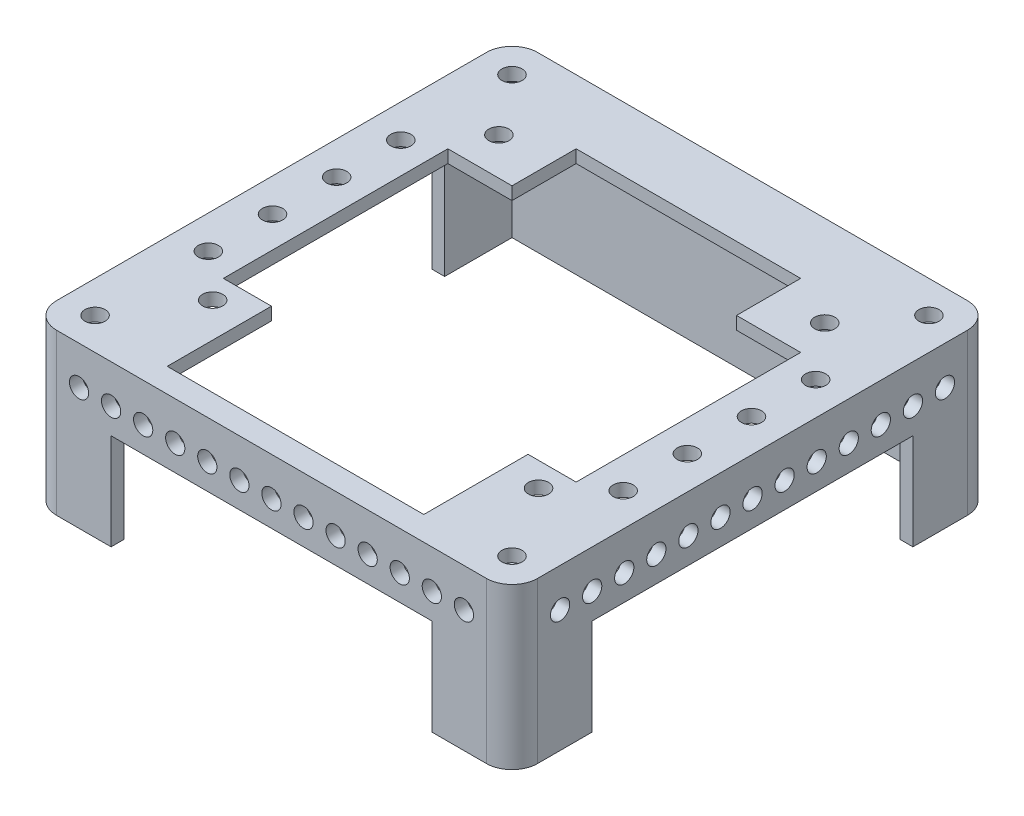
from build123d import *

# Parameters (mm, degrees)
SKETCH9_R                 = 3.15
BOSS_EXTRUDE10_DEPTH      = 10
BOSS_EXTRUDE10_2_DEPTH    = 10
BOSS_EXTRUDE10_3_DEPTH    = 10
BOSS_EXTRUDE10_4_DEPTH    = 10
BOSS_EXTRUDE10_5_DEPTH    = 10
BOSS_EXTRUDE10_6_DEPTH    = 10
BOSS_EXTRUDE10_7_DEPTH    = 10
BOSS_EXTRUDE10_8_DEPTH    = 10
BOSS_EXTRUDE12_DEPTH      = 10
SKETCH15_R                = 3.15
BOSS_EXTRUDE17_DEPTH      = 10
BOSS_EXTRUDE17_2_DEPTH    = 10
BOSS_EXTRUDE17_3_DEPTH    = 10
BOSS_EXTRUDE17_4_DEPTH    = 10
SKETCH22_W                = 150
SKETCH22_H                = 150
BOSS_EXTRUDE19_DEPTH      = 4
SKETCH29_W                = 150
SKETCH29_H                = 150
SKETCH29_W_2              = 142
SKETCH29_H_2              = 142
BOSS_EXTRUDE20_DEPTH      = 50
FILLET12_R                = 8
BOSS_EXTRUDE21_START      = -20
SKETCH31_W                = 8
SKETCH31_H                = 100
BOSS_EXTRUDE21_DEPTH      = 100
BOSS_EXTRUDE21_2_DEPTH    = 100
SKETCH31_W_2              = 100
SKETCH31_H_2              = 8
BOSS_EXTRUDE21_3_DEPTH    = 100
SKETCH35_R                = 3.15
BOSS_EXTRUDE25_DEPTH      = 10
BOSS_EXTRUDE25_2_DEPTH    = 10
BOSS_EXTRUDE25_3_DEPTH    = 10
BOSS_EXTRUDE25_4_DEPTH    = 10
BOSS_EXTRUDE27_DEPTH      = 11
BOSS_EXTRUDE27_DEPTH_BACK = 46
SKETCH38_W                = 80
SKETCH38_H                = 35.561756734
BOSS_EXTRUDE28_DEPTH      = 3
BOSS_EXTRUDE28_2_DEPTH    = 3
BOSS_EXTRUDE28_3_DEPTH    = 3
BOSS_EXTRUDE28_4_DEPTH    = 3
SKETCH40_W                = 20
SKETCH40_H                = 20
BOSS_EXTRUDE31_DEPTH      = 4.5
BOSS_EXTRUDE31_2_DEPTH    = 4.5
BOSS_EXTRUDE31_3_DEPTH    = 4.5
BOSS_EXTRUDE31_4_DEPTH    = 4.5
FILLET14_R                = 15
SKETCH42_R                = 3
CUT_EXTRUDE1_DEPTH        = 10
SKETCH45_R                = 3
CUT_EXTRUDE2_DEPTH        = 174.899396204


with BuildPart() as part:
    # Sketch9 → Boss-Extrude10 (new, symmetric)
    with BuildSketch(Plane(origin=(0, 0, 0), x_dir=(1, 0, 0), z_dir=(0, 1, 0))):
        with Locations(Location((64.67, -30, 0), (0, 0, 270))):
            Circle(SKETCH9_R)
    extrude(amount=BOSS_EXTRUDE10_DEPTH, both=True)


with BuildPart() as body_2:
    # Sketch9 → Boss-Extrude10 2 (new, symmetric)
    with BuildSketch(Plane(origin=(0, 0, 0), x_dir=(1, 0, 0), z_dir=(0, 1, 0))):
        with Locations(Location((-64.67, -30, 0), (0, 0, 270))):
            Circle(SKETCH9_R)
    extrude(amount=BOSS_EXTRUDE10_2_DEPTH, both=True)


with BuildPart() as body_3:
    # Sketch9 → Boss-Extrude10 3 (new, symmetric)
    with BuildSketch(Plane(origin=(0, 0, 0), x_dir=(1, 0, 0), z_dir=(0, 1, 0))):
        with Locations(Location((64.67, -10, 0), (0, 0, 270))):
            Circle(SKETCH9_R)
    extrude(amount=BOSS_EXTRUDE10_3_DEPTH, both=True)


with BuildPart() as body_4:
    # Sketch9 → Boss-Extrude10 4 (new, symmetric)
    with BuildSketch(Plane(origin=(0, 0, 0), x_dir=(1, 0, 0), z_dir=(0, 1, 0))):
        with Locations(Location((-64.67, -10, 0), (0, 0, 270))):
            Circle(SKETCH9_R)
    extrude(amount=BOSS_EXTRUDE10_4_DEPTH, both=True)


with BuildPart() as body_5:
    # Sketch9 → Boss-Extrude10 5 (new, symmetric)
    with BuildSketch(Plane(origin=(0, 0, 0), x_dir=(1, 0, 0), z_dir=(0, 1, 0))):
        with Locations(Location((64.67, 10, 0), (0, 0, 270))):
            Circle(SKETCH9_R)
    extrude(amount=BOSS_EXTRUDE10_5_DEPTH, both=True)


with BuildPart() as body_6:
    # Sketch9 → Boss-Extrude10 6 (new, symmetric)
    with BuildSketch(Plane(origin=(0, 0, 0), x_dir=(1, 0, 0), z_dir=(0, 1, 0))):
        with Locations(Location((-64.67, 10, 0), (0, 0, 270))):
            Circle(SKETCH9_R)
    extrude(amount=BOSS_EXTRUDE10_6_DEPTH, both=True)


with BuildPart() as body_7:
    # Sketch9 → Boss-Extrude10 7 (new, symmetric)
    with BuildSketch(Plane(origin=(0, 0, 0), x_dir=(1, 0, 0), z_dir=(0, 1, 0))):
        with Locations(Location((64.67, 30, 0), (0, 0, 270))):
            Circle(SKETCH9_R)
    extrude(amount=BOSS_EXTRUDE10_7_DEPTH, both=True)


with BuildPart() as body_8:
    # Sketch9 → Boss-Extrude10 8 (new, symmetric)
    with BuildSketch(Plane(origin=(0, 0, 0), x_dir=(1, 0, 0), z_dir=(0, 1, 0))):
        with Locations(Location((-64.67, 30, 0), (0, 0, 270))):
            Circle(SKETCH9_R)
    extrude(amount=BOSS_EXTRUDE10_8_DEPTH, both=True)


with BuildPart() as body_9:
    # Sketch10 → Boss-Extrude12 (new, symmetric)
    with BuildSketch(Plane(origin=(0, 0, 0), x_dir=(1, 0, 0), z_dir=(0, 1, 0))):
        Polygon((35, -55), (35, -35), (55, -35), (55, 35), (35, 35), (35, 55), (-35, 55), (-35, 35), (-55, 35), (-55, -35), (-35, -35), (-35, -55), align=None)
    extrude(amount=BOSS_EXTRUDE12_DEPTH, both=True)


with BuildPart() as body_10:
    # Sketch15 → Boss-Extrude17 (new, symmetric)
    with BuildSketch(Plane(origin=(0, 0, 0), x_dir=(1, 0, 0), z_dir=(0, 1, 0))):
        with Locations(Location((-50.8, 46.711, 0), (0, 0, 270))):
            Circle(SKETCH15_R)
    extrude(amount=BOSS_EXTRUDE17_DEPTH, both=True)


with BuildPart() as body_11:
    # Sketch15 → Boss-Extrude17 2 (new, symmetric)
    with BuildSketch(Plane(origin=(0, 0, 0), x_dir=(1, 0, 0), z_dir=(0, 1, 0))):
        with Locations(Location((50.8, -42.532, 0), (0, 0, 270))):
            Circle(SKETCH15_R)
    extrude(amount=BOSS_EXTRUDE17_2_DEPTH, both=True)


with BuildPart() as body_12:
    # Sketch15 → Boss-Extrude17 3 (new, symmetric)
    with BuildSketch(Plane(origin=(0, 0, 0), x_dir=(1, 0, 0), z_dir=(0, 1, 0))):
        with Locations(Location((-50.8, -42.532, 0), (0, 0, 270))):
            Circle(SKETCH15_R)
    extrude(amount=BOSS_EXTRUDE17_3_DEPTH, both=True)


with BuildPart() as body_13:
    # Sketch15 → Boss-Extrude17 4 (new, symmetric)
    with BuildSketch(Plane(origin=(0, 0, 0), x_dir=(1, 0, 0), z_dir=(0, 1, 0))):
        with Locations(Location((50.8, 46.711, 0), (0, 0, 270))):
            Circle(SKETCH15_R)
    extrude(amount=BOSS_EXTRUDE17_4_DEPTH, both=True)


with BuildPart() as body_10_1:
    # Body-Move/Copy4: moved
    add(body_10.part.moved(Location((0, 1, 0))))


with BuildPart() as body_13_1:
    # Body-Move/Copy4: moved
    add(body_13.part.moved(Location((0, 1, 0))))


with BuildPart() as body_12_1:
    # Body-Move/Copy4: moved
    add(body_12.part.moved(Location((0, 1, 0))))


with BuildPart() as body_11_1:
    # Body-Move/Copy4: moved
    add(body_11.part.moved(Location((0, 1, 0))))


with BuildPart() as body_14:
    # Sketch22 → Boss-Extrude19 (new body)
    with BuildSketch(Plane(origin=(0, 0, 0), x_dir=(1, 0, 0), z_dir=(0, 1, 0))):
        Rectangle(SKETCH22_W, SKETCH22_H)
    extrude(amount=BOSS_EXTRUDE19_DEPTH)

    # Sketch29 → Boss-Extrude20 (add)
    with BuildSketch(Plane(origin=(0, 4, 0), x_dir=(1, 0, 0), z_dir=(0, 1, 0))):
        Rectangle(SKETCH29_W, SKETCH29_H)
        Rectangle(SKETCH29_W_2, SKETCH29_H_2, mode=Mode.SUBTRACT)
    extrude(amount=-BOSS_EXTRUDE20_DEPTH)

    # Fillet12
    fillet12_edges = [body_14.edges().sort_by_distance(p)[0] for p in [
        (75, -21, 75),
        (-75, -21, 75),
        (-75, -21, -75),
        (75, -21, -75),
    ]]
    fillet(fillet12_edges, radius=FILLET12_R)


with BuildPart() as body_15:
    # Sketch31 → Boss-Extrude21 (new body)
    with BuildSketch(Plane(origin=(0, 4, 0), x_dir=(1, 0, 0), z_dir=(0, 1, 0)).offset(BOSS_EXTRUDE21_START)):
        with Locations((-75, 0)):
            Rectangle(SKETCH31_W, SKETCH31_H)
    extrude(amount=-BOSS_EXTRUDE21_DEPTH)


with BuildPart() as body_16:
    # Sketch31 → Boss-Extrude21 2 (new body)
    with BuildSketch(Plane(origin=(0, 4, 0), x_dir=(1, 0, 0), z_dir=(0, 1, 0)).offset(BOSS_EXTRUDE21_START)):
        with Locations((75, 0)):
            Rectangle(SKETCH31_W, SKETCH31_H)
    extrude(amount=-BOSS_EXTRUDE21_2_DEPTH)


with BuildPart() as body_17:
    # Sketch31 → Boss-Extrude21 3 (new body)
    with BuildSketch(Plane(origin=(0, 4, 0), x_dir=(1, 0, 0), z_dir=(0, 1, 0)).offset(BOSS_EXTRUDE21_START)):
        with Locations((0, -75)):
            Rectangle(SKETCH31_W_2, SKETCH31_H_2)
    extrude(amount=-BOSS_EXTRUDE21_3_DEPTH)


with BuildPart() as body_14_1:
    add(body_14.part)

    # Combine4: cut body 15, body 16, body 17
    add(body_15.part, mode=Mode.SUBTRACT)
    add(body_16.part, mode=Mode.SUBTRACT)
    add(body_17.part, mode=Mode.SUBTRACT)


with BuildPart() as body_15_2:
    # Sketch35 → Boss-Extrude25 (new, symmetric)
    with BuildSketch(Plane(origin=(0, 0, 0), x_dir=(1, 0, 0), z_dir=(0, 1, 0))):
        with Locations(Location((65, -65, 0), (0, 0, 270))):
            Circle(SKETCH35_R)
    extrude(amount=BOSS_EXTRUDE25_DEPTH, both=True)


with BuildPart() as body_16_2:
    # Sketch35 → Boss-Extrude25 2 (new, symmetric)
    with BuildSketch(Plane(origin=(0, 0, 0), x_dir=(1, 0, 0), z_dir=(0, 1, 0))):
        with Locations(Location((-65, 65, 0), (0, 0, 270))):
            Circle(SKETCH35_R)
    extrude(amount=BOSS_EXTRUDE25_2_DEPTH, both=True)


with BuildPart() as body_17_2:
    # Sketch35 → Boss-Extrude25 3 (new, symmetric)
    with BuildSketch(Plane(origin=(0, 0, 0), x_dir=(1, 0, 0), z_dir=(0, 1, 0))):
        with Locations(Location((-65, -65, 0), (0, 0, 270))):
            Circle(SKETCH35_R)
    extrude(amount=BOSS_EXTRUDE25_3_DEPTH, both=True)


with BuildPart() as body_18:
    # Sketch35 → Boss-Extrude25 4 (new, symmetric)
    with BuildSketch(Plane(origin=(0, 0, 0), x_dir=(1, 0, 0), z_dir=(0, 1, 0))):
        with Locations(Location((65, 65, 0), (0, 0, 270))):
            Circle(SKETCH35_R)
    extrude(amount=BOSS_EXTRUDE25_4_DEPTH, both=True)


with BuildPart() as body_19:
    # Sketch38 → Boss-Extrude27 (new, two sides: drawn at the far end of the back side and taken through both)
    with BuildSketch(Plane(origin=(0, 0, 0), x_dir=(1, 0, 0), z_dir=(0, 1, 0)).offset(-BOSS_EXTRUDE27_DEPTH_BACK)):
        with Locations((0, -49.719121633)):
            Rectangle(SKETCH38_W, SKETCH38_H)
    extrude(amount=BOSS_EXTRUDE27_DEPTH + BOSS_EXTRUDE27_DEPTH_BACK)


with BuildPart() as body_14_2:
    add(body_14_1.part)

    # Combine12: cut body 19, body 17 2, body 16 2, body 15 2, body 18
    add(body_19.part, mode=Mode.SUBTRACT)
    add(body_17_2.part, mode=Mode.SUBTRACT)
    add(body_16_2.part, mode=Mode.SUBTRACT)
    add(body_15_2.part, mode=Mode.SUBTRACT)
    add(body_18.part, mode=Mode.SUBTRACT)

    # Combine13: cut body 11, body 12, body 13, body 10, body 9, body 2, part
    add(body_11_1.part, mode=Mode.SUBTRACT)
    add(body_12_1.part, mode=Mode.SUBTRACT)
    add(body_13_1.part, mode=Mode.SUBTRACT)
    add(body_10_1.part, mode=Mode.SUBTRACT)
    add(body_9.part, mode=Mode.SUBTRACT)
    add(body_2.part, mode=Mode.SUBTRACT)
    add(part.part, mode=Mode.SUBTRACT)


with BuildPart() as body_8_2:
    # Sketch36 → Boss-Extrude28 (new body)
    with BuildSketch(Plane(origin=(0, 0, 0), x_dir=(1, 0, 0), z_dir=(0, 1, 0))):
        with BuildLine():
            Line((-40.150757595, -52.878679656), (-57.121320344, -69.849242405))
            ThreePointArc((-57.121320344, -69.849242405), (-69.849242405, -69.849242405), (-69.849242405, -57.121320344))
            Line((-69.849242405, -57.121320344), (-52.878679656, -40.150757595))
            ThreePointArc((-52.878679656, -40.150757595), (-40.150757595, -40.150757595), (-40.150757595, -52.878679656))
        make_face()
    extrude(amount=-BOSS_EXTRUDE28_DEPTH)


with BuildPart() as body_9_2:
    # Sketch36 → Boss-Extrude28 2 (new body)
    with BuildSketch(Plane(origin=(0, 0, 0), x_dir=(1, 0, 0), z_dir=(0, 1, 0))):
        with BuildLine():
            Line((-52.878679656, 40.150757595), (-69.849242405, 57.121320344))
            ThreePointArc((-69.849242405, 57.121320344), (-69.849242405, 69.849242405), (-57.121320344, 69.849242405))
            Line((-57.121320344, 69.849242405), (-40.150757595, 52.878679656))
            ThreePointArc((-40.150757595, 52.878679656), (-40.150757595, 40.150757595), (-52.878679656, 40.150757595))
        make_face()
    extrude(amount=-BOSS_EXTRUDE28_2_DEPTH)


with BuildPart() as body_10_2:
    # Sketch36 → Boss-Extrude28 3 (new body)
    with BuildSketch(Plane(origin=(0, 0, 0), x_dir=(1, 0, 0), z_dir=(0, 1, 0))):
        with BuildLine():
            Line((52.878679656, -40.150757595), (69.849242405, -57.121320344))
            ThreePointArc((69.849242405, -57.121320344), (69.849242405, -69.849242405), (57.121320344, -69.849242405))
            Line((57.121320344, -69.849242405), (40.150757595, -52.878679656))
            ThreePointArc((40.150757595, -52.878679656), (40.150757595, -40.150757595), (52.878679656, -40.150757595))
        make_face()
    extrude(amount=-BOSS_EXTRUDE28_3_DEPTH)


with BuildPart() as body_11_2:
    # Sketch36 → Boss-Extrude28 4 (new body)
    with BuildSketch(Plane(origin=(0, 0, 0), x_dir=(1, 0, 0), z_dir=(0, 1, 0))):
        with BuildLine():
            Line((40.150757595, 52.878679656), (57.121320344, 69.849242405))
            ThreePointArc((57.121320344, 69.849242405), (69.849242405, 69.849242405), (69.849242405, 57.121320344))
            Line((69.849242405, 57.121320344), (52.878679656, 40.150757595))
            ThreePointArc((52.878679656, 40.150757595), (40.150757595, 40.150757595), (40.150757595, 52.878679656))
        make_face()
    extrude(amount=-BOSS_EXTRUDE28_4_DEPTH)


with BuildPart() as body_12_2:
    # Sketch40 → Boss-Extrude31 (new body)
    with BuildSketch(Plane(origin=(0, 0, 0), x_dir=(1, 0, 0), z_dir=(0, 1, 0))):
        with Locations((61, -61)):
            Rectangle(SKETCH40_W, SKETCH40_H)
    extrude(amount=-BOSS_EXTRUDE31_DEPTH)


with BuildPart() as body_13_2:
    # Sketch40 → Boss-Extrude31 2 (new body)
    with BuildSketch(Plane(origin=(0, 0, 0), x_dir=(1, 0, 0), z_dir=(0, 1, 0))):
        with Locations((61, 61)):
            Rectangle(SKETCH40_W, SKETCH40_H)
    extrude(amount=-BOSS_EXTRUDE31_2_DEPTH)


with BuildPart() as body_14_2_1:
    # Sketch40 → Boss-Extrude31 3 (new body)
    with BuildSketch(Plane(origin=(0, 0, 0), x_dir=(1, 0, 0), z_dir=(0, 1, 0))):
        with Locations((-61, 61)):
            Rectangle(SKETCH40_W, SKETCH40_H)
    extrude(amount=-BOSS_EXTRUDE31_3_DEPTH)


with BuildPart() as body_15_3:
    # Sketch40 → Boss-Extrude31 4 (new body)
    with BuildSketch(Plane(origin=(0, 0, 0), x_dir=(1, 0, 0), z_dir=(0, 1, 0))):
        with Locations((-61, -61)):
            Rectangle(SKETCH40_W, SKETCH40_H)
    extrude(amount=-BOSS_EXTRUDE31_4_DEPTH)


with BuildPart() as body_12_2_1:
    add(body_12_2.part)

    # Combine15: union body 13 2, body 14 2, body 15 3, body 14
    add(body_13_2.part)
    add(body_14_2_1.part)
    add(body_15_3.part)
    add(body_14_2.part)

    # Combine16: cut body 11 2, body 10 2, body 9 2, body 8 2
    add(body_11_2.part, mode=Mode.SUBTRACT)
    add(body_10_2.part, mode=Mode.SUBTRACT)
    add(body_9_2.part, mode=Mode.SUBTRACT)
    add(body_8_2.part, mode=Mode.SUBTRACT)

    # Combine17: cut body 8, body 7, body 6, body 5, body 4, body 3
    add(body_8.part, mode=Mode.SUBTRACT)
    add(body_7.part, mode=Mode.SUBTRACT)
    add(body_6.part, mode=Mode.SUBTRACT)
    add(body_5.part, mode=Mode.SUBTRACT)
    add(body_4.part, mode=Mode.SUBTRACT)
    add(body_3.part, mode=Mode.SUBTRACT)

    # Fillet14
    # the kernel refuses this fillet: 15 mm, written as the material it takes off along each edge
    with BuildSketch(Plane(origin=(-51, 34.5, 51), x_dir=(-1, 0, 0), z_dir=(0, -1, 0))) as fillet14_piece_1_section:
        with BuildLine():
            CenterArc((FILLET14_R, -FILLET14_R), FILLET14_R, 90, 90)
            Line((0, -FILLET14_R), (0, 0))
            Line((0, 0), (FILLET14_R, 0))
        make_face()
    fillet14_piece_1 = extrude(amount=76.5, mode=Mode.PRIVATE)
    fillet14_piece_1 = split(fillet14_piece_1, bisect_by=Plane(origin=(-64.35249566, 0, 51.045676814), z_dir=(0, -1, 0)), keep=Keep.TOP, mode=Mode.PRIVATE)
    add(fillet14_piece_1, mode=Mode.SUBTRACT)
    with BuildSketch(Plane(origin=(-51, 34.5, -51), x_dir=(-1, 0, 0), z_dir=(0, -1, 0))) as fillet14_piece_2_section:
        with BuildLine():
            CenterArc((FILLET14_R, FILLET14_R), FILLET14_R, 180, 90)
            Line((0, FILLET14_R), (0, 0))
            Line((0, 0), (FILLET14_R, 0))
        make_face()
    fillet14_piece_2 = extrude(amount=76.5, mode=Mode.PRIVATE)
    fillet14_piece_2 = split(fillet14_piece_2, bisect_by=Plane(origin=(-64.35249566, 0, -51.045676814), z_dir=(0, -1, 0)), keep=Keep.TOP, mode=Mode.PRIVATE)
    add(fillet14_piece_2, mode=Mode.SUBTRACT)
    with BuildSketch(Plane(origin=(51, 34.5, -51), x_dir=(0, 0, -1), z_dir=(0, -1, 0))) as fillet14_piece_3_section:
        with BuildLine():
            CenterArc((FILLET14_R, FILLET14_R), FILLET14_R, 180, 90)
            Line((0, FILLET14_R), (0, 0))
            Line((0, 0), (FILLET14_R, 0))
        make_face()
    fillet14_piece_3 = extrude(amount=76.5, mode=Mode.PRIVATE)
    fillet14_piece_3 = split(fillet14_piece_3, bisect_by=Plane(origin=(51.045676814, 0, -64.35249566), z_dir=(0, -1, 0)), keep=Keep.TOP, mode=Mode.PRIVATE)
    add(fillet14_piece_3, mode=Mode.SUBTRACT)
    with BuildSketch(Plane(origin=(51, 34.5, 51), x_dir=(1, 0, 0), z_dir=(0, -1, 0))) as fillet14_piece_4_section:
        with BuildLine():
            CenterArc((FILLET14_R, FILLET14_R), FILLET14_R, 180, 90)
            Line((0, FILLET14_R), (0, 0))
            Line((0, 0), (FILLET14_R, 0))
        make_face()
    fillet14_piece_4 = extrude(amount=76.5, mode=Mode.PRIVATE)
    fillet14_piece_4 = split(fillet14_piece_4, bisect_by=Plane(origin=(64.35249566, 0, 51.045676814), z_dir=(0, -1, 0)), keep=Keep.TOP, mode=Mode.PRIVATE)
    add(fillet14_piece_4, mode=Mode.SUBTRACT)

    # Sketch42 → Cut-Extrude1 (cut)
    with BuildSketch(Plane.XY.offset(75)):
        with Locations((60, -8)):
            Circle(SKETCH42_R)
        with Locations((50, -8)):
            Circle(SKETCH42_R)
        with Locations((40, -8)):
            Circle(SKETCH42_R)
        with Locations((30, -8)):
            Circle(SKETCH42_R)
        with Locations((20, -8)):
            Circle(SKETCH42_R)
        with Locations((10, -8)):
            Circle(SKETCH42_R)
        with Locations((0, -8)):
            Circle(SKETCH42_R)
        with Locations((-10, -8)):
            Circle(SKETCH42_R)
        with Locations((-20, -8)):
            Circle(SKETCH42_R)
        with Locations((-30, -8)):
            Circle(SKETCH42_R)
        with Locations((-40, -8)):
            Circle(SKETCH42_R)
        with Locations((-50, -8)):
            Circle(SKETCH42_R)
        with Locations((-60, -8)):
            Circle(SKETCH42_R)
    extrude(amount=-CUT_EXTRUDE1_DEPTH, mode=Mode.SUBTRACT)

    # Sketch45 → Cut-Extrude2 (cut, through all)
    with BuildSketch(Plane.ZY.offset(75)):
        with Locations((-60, -8)):
            Circle(SKETCH45_R)
        with Locations((-50, -8)):
            Circle(SKETCH45_R)
        with Locations((-40, -8)):
            Circle(SKETCH45_R)
        with Locations((-30, -8)):
            Circle(SKETCH45_R)
        with Locations((-20, -8)):
            Circle(SKETCH45_R)
        with Locations((-10, -8)):
            Circle(SKETCH45_R)
        with Locations((0, -8)):
            Circle(SKETCH45_R)
        with Locations((10, -8)):
            Circle(SKETCH45_R)
        with Locations((20, -8)):
            Circle(SKETCH45_R)
        with Locations((30, -8)):
            Circle(SKETCH45_R)
        with Locations((40, -8)):
            Circle(SKETCH45_R)
        with Locations((50, -8)):
            Circle(SKETCH45_R)
        with Locations((60, -8)):
            Circle(SKETCH45_R)
    extrude(amount=-CUT_EXTRUDE2_DEPTH, mode=Mode.SUBTRACT)


solid = body_12_2_1.part
